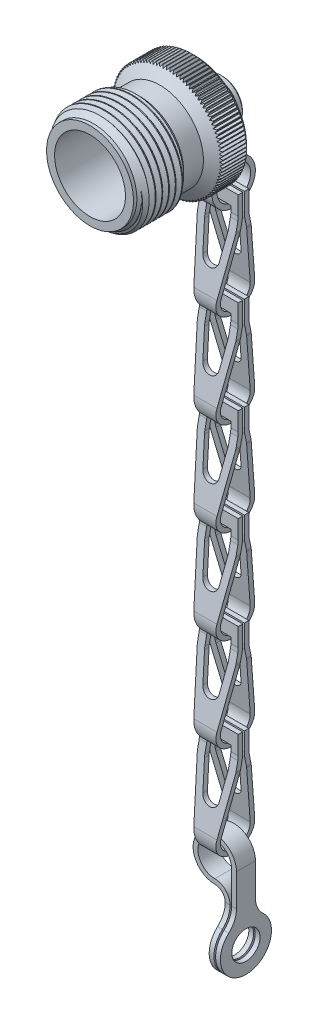
from build123d import *

# Parameters (mm, degrees)
SKETCH14_R            = 0.8001
CUT_EXTRUDE4_DEPTH    = 4.6481873
SKETCH15_R            = 0.1984375
BOSS_EXTRUDE3_DEPTH   = 0.635
BOSS_EXTRUDE1_DEPTH   = 4.064
SKETCH10_OUTSIDE_W    = 27.038
SKETCH10_OUTSIDE_H    = 32.537
SKETCH10_OUTSIDE_R    = 2.2352
CUT_EXTRUDE2_DEPTH    = 8.128
BOSS_EXTRUDE2_DEPTH   = 3.048
CUT_EXTRUDE3_START    = -21.1074
CUT_EXTRUDE3_DEPTH    = 24.6634
LPATTERN1_COUNT       = 6
LPATTERN1_PITCH       = 14.7828
BODY_MOVE_COPY1_ANGLE = 90
CUT_SWEEP1_PITCH      = 1.0583418
CUT_EXTRUDE1_REACH    = 121.508
CIRPATTERN1_COUNT     = 100


with BuildPart() as part:
    # Sketch3 → Revolve1 (revolve)
    with BuildSketch(Plane(origin=(0, 0, 0), x_dir=(0, 0, -1), z_dir=(1, 0, 0)), mode=Mode.PRIVATE) as revolve1_sk:
        Polygon((0.5291709, 6.8791582), (0, 6.8791582), (0, 5.6091582), (11.0617127, 5.6091582), (11.0617127, 2.1082), (17.2974, 2.1082), (17.2974, 4.2164), (16.6624, 4.8514), (16.6624, 8.0899), (16.0274, 8.7249), (12.3113927, 8.7249), (11.0617127, 6.8791582), (7.9375127, 6.8791582), (6.8791709, 7.9375), (1.5875127, 7.9375), align=None)
    revolve(revolve1_sk.sketch.rotate(Axis((0, 0, -16.6624), (0, 0, 1)), 90), axis=Axis((0, 0, -16.6624), (0, 0, 1)))

    # Sketch13 → Revolve4 (revolve)
    with BuildSketch(Plane(origin=(0, 0, 0), x_dir=(0, 0, -1), z_dir=(1, 0, 0)), mode=Mode.PRIVATE) as revolve4_sk:
        Polygon((16.6624, 2.1082), (17.2974, 1.0541), (17.2974, 2.1082), align=None)
    revolve(revolve4_sk.sketch.rotate(Axis((0, 0, 0), (0, 0, -1)), 270), axis=Axis((0, 0, 0), (0, 0, -1)))

    # Cut-Sweep1: arcs per turn and ends read off the stored shape
    # Cut-Sweep1: the profile of Sketch5 screwed along a right-hand helix through 8.499952 turns, 8 arcs to a turn; built about Z, then put on its axis
    cut_sweep1_z = Axis((0, 0, 0), (0, 0, 1))
    cut_sweep1_corners = [(7.250086836, 0, -0.396878175), (7.99478443, 0, 0.033073181), (7.99478443, 0, -0.959122256), (7.250086836, 0, -0.5291709)]
    with BuildLine(mode=Mode.PRIVATE) as cut_sweep1_profile:
        Line(cut_sweep1_corners[0], cut_sweep1_corners[1])
        Line(cut_sweep1_corners[1], cut_sweep1_corners[2])
        Line(cut_sweep1_corners[2], cut_sweep1_corners[3])
        Line(cut_sweep1_corners[3], cut_sweep1_corners[0])
    cut_sweep1_cap = Face(cut_sweep1_profile.wire())
    cut_sweep1_turn_angles = [0, 22.5, 45, 67.5, 90, 112.5, 135, 157.5, 180, 202.5, 225, 247.5, 270, 292.5, 315, 337.5, 360]
    cut_sweep1_turn_weights = [1, 0.9238795325112867, 1, 0.9238795325112867, 1, 0.9238795325112867, 1, 0.9238795325112867, 1, 0.9238795325112867, 1, 0.9238795325112867, 1, 0.9238795325112867, 1, 0.9238795325112867, 1]
    cut_sweep1_turn_rails = [Edge.make_bspline([Vector(p[0], p[1], 0).rotate(cut_sweep1_z, cut_sweep1_turn_angles[k]) / cut_sweep1_turn_weights[k] + Vector(0, 0, p[2] + CUT_SWEEP1_PITCH * cut_sweep1_turn_angles[k] / 360) for k in range(17)], [0, 0, 0, 1, 1, 2, 2, 3, 3, 4, 4, 5, 5, 6, 6, 7, 7, 8, 8, 8], 2, cut_sweep1_turn_weights) for p in cut_sweep1_corners]
    cut_sweep1_turn_sides = [Face.make_surface_from_curves(cut_sweep1_turn_rails[p[0]], cut_sweep1_turn_rails[p[1]]) for p in [(0, 1), (1, 2), (2, 3), (3, 0)]]
    cut_sweep1_last_angles = [2880, 2902.5, 2925, 2947.5, 2970, 2992.5, 3015, 3037.491360069, 3059.982720138]
    cut_sweep1_last_weights = [1, 0.9238795325112867, 1, 0.9238795325112867, 1, 0.9238795325112867, 1, 0.9239372288473554, 1]
    cut_sweep1_last_rails = [Edge.make_bspline([Vector(p[0], p[1], 0).rotate(cut_sweep1_z, cut_sweep1_last_angles[k]) / cut_sweep1_last_weights[k] + Vector(0, 0, p[2] + CUT_SWEEP1_PITCH * cut_sweep1_last_angles[k] / 360) for k in range(9)], [0, 0, 0, 1, 1, 2, 2, 3, 3, 4, 4, 4], 2, cut_sweep1_last_weights) for p in cut_sweep1_corners]
    cut_sweep1_last_sides = [Face.make_surface_from_curves(cut_sweep1_last_rails[p[0]], cut_sweep1_last_rails[p[1]]) for p in [(0, 1), (1, 2), (2, 3), (3, 0)]]
    cut_sweep1 = Plane(origin=(0, 0, 0), x_dir=(0, 1, 0), z_dir=(0, 0, -1)) * Solid(Shell([*[p.moved(Location((0, 0, CUT_SWEEP1_PITCH * i))) for i in range(8) for p in cut_sweep1_turn_sides], *cut_sweep1_last_sides, cut_sweep1_cap, cut_sweep1_cap.rotate(cut_sweep1_z, 3059.982720138).moved(Location((0, 0, CUT_SWEEP1_PITCH * 3059.982720138 / 360)))]))
    add(cut_sweep1, mode=Mode.SUBTRACT)

    # Cut-Extrude1: up to this cone (the profile starts inside it)
    cut_extrude1_end = Plane(origin=(0, 0, -11.061713), z_dir=(0, 0, 1)).offset(-13.690586) * Cone(1e-06, 149.389174, 149.389173, align=(Align.CENTER, Align.CENTER, Align.MIN), mode=Mode.PRIVATE)
    # Sketch6 → Cut-Extrude1 (cut, up to the surface)
    with BuildSketch(Plane.XY.offset(-11.0617127), mode=Mode.PRIVATE) as cut_extrude1_sk1:
        with BuildLine():
            Line((-0.228391256, 8.721910195), (0, 8.4074))
            Line((0, 8.4074), (0.228391256, 8.721910195))
            ThreePointArc((0.228391256, 8.721910195), (0, 8.7249), (-0.228391256, 8.721910195))
        make_face()
    cut_extrude1_tool1 = extrude(cut_extrude1_sk1.sketch, amount=-CUT_EXTRUDE1_REACH, mode=Mode.PRIVATE) & cut_extrude1_end
    cut_extrude1 = cut_extrude1_tool1.solids().sort_by_distance((0, 8.618401, -11.061713))[0]
    add(cut_extrude1, mode=Mode.SUBTRACT)

    # CirPattern1: Cut-Extrude1 ×100 about axis
    cirpattern1_axis = Axis((0, 0, 0), (0, 0, 1))
    for i in range(1, CIRPATTERN1_COUNT):
        add(cut_extrude1.rotate(cirpattern1_axis, i * 360 / CIRPATTERN1_COUNT), mode=Mode.SUBTRACT)


with BuildPart() as body_2:
    # Sketch8 → Revolve3 (revolve)
    with BuildSketch(Plane(origin=(0, 0, 0), x_dir=(0, 0, -1), z_dir=(1, 0, 0))):
        Polygon((20.0914, 2.1082), (20.0914, 3.3782), (20.7264, 3.3782), (20.9804, 3.1242), (20.9804, 0), (11.0617127, 0), (11.0617127, 1.0541), (17.2974, 1.0541), (17.2974, 2.1082), align=None)
    revolve(axis=Axis((0, 0, -20.9804), (0, 0, 1)))

    # Sketch14 → Cut-Extrude4 (cut)
    with BuildSketch(Plane.XY.offset(-11.0617127)):
        Circle(SKETCH14_R)
    extrude(amount=-CUT_EXTRUDE4_DEPTH, mode=Mode.SUBTRACT)

    # Sketch15 → Boss-Extrude3 (add)
    with BuildSketch(Plane.XY.offset(-15.7099)):
        with Locations(Location((0, 0, 0), (0, 0, 180))):
            Circle(SKETCH15_R)
    extrude(amount=BOSS_EXTRUDE3_DEPTH)


with BuildPart() as body_3:
    # Sketch9 → Boss-Extrude1 (new, symmetric)
    with BuildSketch(Plane(origin=(0, 0, 0), x_dir=(0, 0, -1), z_dir=(1, 0, 0))):
        with BuildLine():
            Line((18.5674, 4.064), (18.5674, -10.795))
            ThreePointArc((18.5674, -10.795), (23.120253785, -12.680853785), (21.2344, -8.128))
            ThreePointArc((21.2344, -8.128), (19.528151337, -7.421248663), (18.8214, -5.715))
            Line((18.8214, -5.715), (18.8214, 4.064))
            Line((18.8214, 4.064), (19.5834, 4.064))
            Line((19.5834, 4.064), (19.5834, -5.715))
            ThreePointArc((19.5834, -5.715), (20.066966704, -6.882433296), (21.2344, -7.366))
            ThreePointArc((21.2344, -7.366), (23.659069153, -13.219669153), (17.8054, -10.795))
            Line((17.8054, -10.795), (17.8054, 4.064))
            Line((17.8054, 4.064), (18.5674, 4.064))
        make_face()
    extrude(amount=BOSS_EXTRUDE1_DEPTH, both=True)

    # Sketch10 outside → Cut-Extrude2 (cut)
    # profile 1 of 2: a face of its own
    with BuildSketch(Plane.XY.offset(-17.8054)):
        with Locations((0, -2.7495)):
            Rectangle(SKETCH10_OUTSIDE_W, SKETCH10_OUTSIDE_H)
        with BuildLine():
            Line((1.4986, -14.224), (-1.4986, -14.224))
            Line((-1.4986, -14.224), (-1.4986, -5.715))
            ThreePointArc((-1.4986, -5.715), (-1.814116528, -4.228218457), (-2.706278351, -2.997723711))
            ThreePointArc((-2.706278351, -2.997723711), (0, 4.0386), (2.706278351, -2.997723711))
            ThreePointArc((2.706278351, -2.997723711), (1.814116528, -4.228218457), (1.4986, -5.715))
            Line((1.4986, -5.715), (1.4986, -14.224))
        make_face(mode=Mode.SUBTRACT)
    # profile 2 of 2: a face of its own
    with BuildSketch(Plane.XY.offset(-17.8054)):
        Circle(SKETCH10_OUTSIDE_R)
    extrude(amount=-CUT_EXTRUDE2_DEPTH, mode=Mode.SUBTRACT)


with BuildPart() as body_4:
    # Sketch11 → Boss-Extrude2 (new, symmetric)
    with BuildSketch(Plane(origin=(0, 0, 0), x_dir=(0, 0, -1), z_dir=(1, 0, 0))):
        with BuildLine():
            Line((21.1074, -11.303), (20.3962, -11.303))
            Line((20.3962, -11.303), (20.3962, -14.224))
            ThreePointArc((20.3962, -14.224), (20.380802317, -14.536311059), (20.334758616, -14.84559291))
            Line((20.334758616, -14.84559291), (18.245383729, -25.311270806))
            ThreePointArc((18.245383729, -25.311270806), (21.2344, -28.956), (24.223416271, -25.311270806))
            Line((24.223416271, -25.311270806), (22.134041384, -14.84559291))
            ThreePointArc((22.134041384, -14.84559291), (22.087997683, -14.536311059), (22.0726, -14.224))
            Line((22.0726, -14.224), (22.0726, -11.303))
            Line((22.0726, -11.303), (21.3614, -11.303))
            Line((21.3614, -11.303), (21.3614, -14.224))
            ThreePointArc((21.3614, -14.224), (21.380246764, -14.606268736), (21.436604254, -14.984829722))
            Line((21.436604254, -14.984829722), (23.525979141, -25.450507618))
            ThreePointArc((23.525979141, -25.450507618), (21.2344, -28.2448), (18.942820859, -25.450507618))
            Line((18.942820859, -25.450507618), (21.032195746, -14.984829722))
            ThreePointArc((21.032195746, -14.984829722), (21.088553236, -14.606268736), (21.1074, -14.224))
            Line((21.1074, -14.224), (21.1074, -11.303))
        make_face()
    extrude(amount=BOSS_EXTRUDE2_DEPTH, both=True)

    # Sketch12 → Cut-Extrude3 (cut)
    with BuildSketch(Plane(origin=(0, 0, -21.1074), x_dir=(-1, 0, 0), z_dir=(0, 0, -1)).offset(CUT_EXTRUDE3_START)):
        with BuildLine():
            Line((-1.8796, -13.335), (1.8796, -13.335))
            Line((1.8796, -13.335), (1.8796, -16.294005194))
            ThreePointArc((1.8796, -16.294005194), (1.872278356, -16.50950191), (1.850347191, -16.724004741))
            Line((1.850347191, -16.724004741), (1.28658531, -20.848316884))
            ThreePointArc((1.28658531, -20.848316884), (0, -21.971), (-1.28658531, -20.848316884))
            Line((-1.28658531, -20.848316884), (-1.850347191, -16.724004741))
            ThreePointArc((-1.850347191, -16.724004741), (-1.872278356, -16.50950191), (-1.8796, -16.294005194))
            Line((-1.8796, -16.294005194), (-1.8796, -13.335))
        make_face()
        with BuildLine():
            Line((-3.048, -16.294005194), (-3.048, -28.956))
            Line((-3.048, -28.956), (-1.3335, -28.956))
            Line((-1.3335, -28.956), (-3.031852449, -16.531364944))
            ThreePointArc((-3.031852449, -16.531364944), (-3.043958452, -16.412959381), (-3.048, -16.294005194))
        make_face()
        with BuildLine():
            Line((1.3335, -28.956), (3.031852449, -16.531364944))
            ThreePointArc((3.031852449, -16.531364944), (3.043958452, -16.412959381), (3.048, -16.294005194))
            Line((3.048, -16.294005194), (3.048, -28.956))
            Line((3.048, -28.956), (1.3335, -28.956))
        make_face()
    extrude(amount=CUT_EXTRUDE3_DEPTH, mode=Mode.SUBTRACT)


with BuildPart() as lpattern1_1:
    # LPattern1: pattern copy
    add(body_4.part.moved(Location(Vector(0, -1, 0) * (1 * LPATTERN1_PITCH))))


with BuildPart() as lpattern1_2:
    # LPattern1: pattern copy
    add(body_4.part.moved(Location(Vector(0, -1, 0) * (2 * LPATTERN1_PITCH))))


with BuildPart() as lpattern1_3:
    # LPattern1: pattern copy
    add(body_4.part.moved(Location(Vector(0, -1, 0) * (3 * LPATTERN1_PITCH))))


with BuildPart() as lpattern1_4:
    # LPattern1: pattern copy
    add(body_4.part.moved(Location(Vector(0, -1, 0) * (4 * LPATTERN1_PITCH))))


with BuildPart() as lpattern1_5:
    # LPattern1: pattern copy
    add(body_4.part.moved(Location(Vector(0, -1, 0) * (5 * LPATTERN1_PITCH))))


with BuildPart() as body_10:
    # Mirror1: mirrored copy
    add(body_3.part.mirror(Plane.ZX.offset(-57.15)))


with BuildPart() as body_10_1:
    # Body-Move/Copy1: moved
    add(body_10.part.rotate(Axis((0, 0, -21.2344), (0, 1, 0)), BODY_MOVE_COPY1_ANGLE))


solid = Compound([part.part, body_2.part, body_3.part, body_4.part, lpattern1_1.part, lpattern1_2.part, lpattern1_3.part, lpattern1_4.part, lpattern1_5.part, body_10_1.part])
